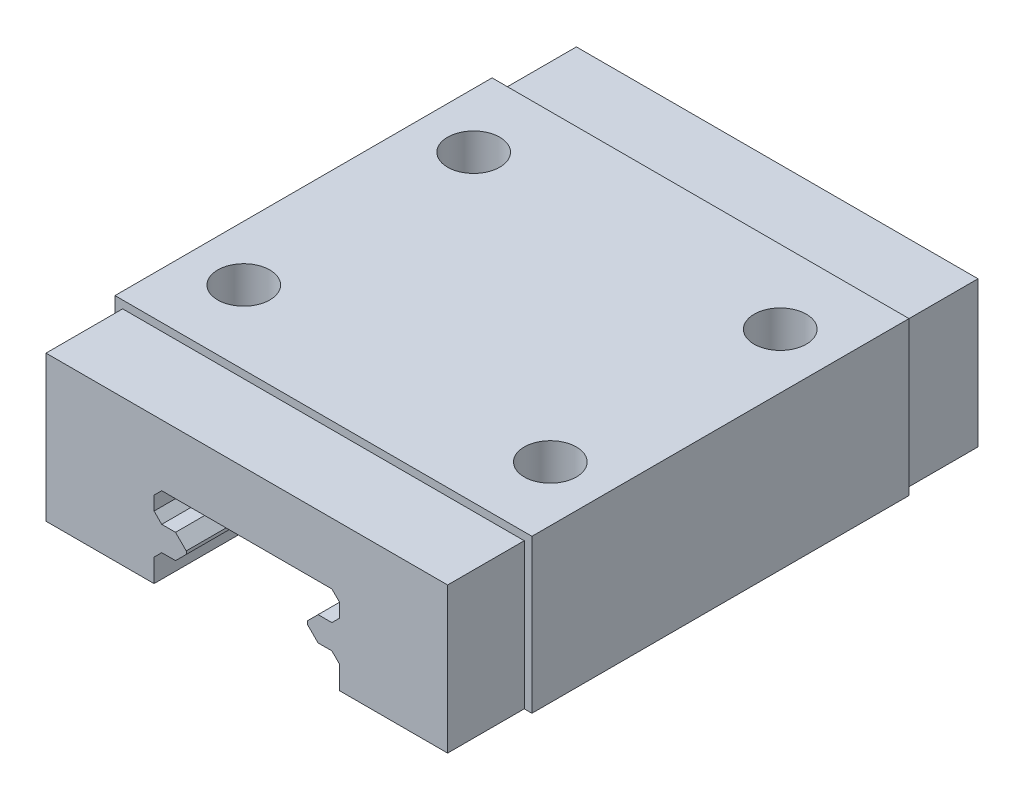
from build123d import *

# Parameters (mm, degrees)
SKETCH1_W                = 27.2
SKETCH1_H                = 10
BOSS_EXTRUDE1_DEPTH      = 34.6
CUT_EXTRUDE1_DEPTH       = 38.511598206
CUT_EXTRUDE1_DEPTH_BACK  = 34.6
CHAMFER1_SIZE            = 0.7
M3_CLEARANCE_HOLE1_D     = 3.4
M3_CLEARANCE_HOLE1_DEPTH = 5
M3_CLEARANCE_HOLE1_TIP   = 1.021463052
SKETCH7_W                = 27.2
SKETCH7_H                = 5
CUT_EXTRUDE2_DEPTH       = 0.5
SKETCH8_W                = 5
SKETCH8_H                = 9.5
CUT_EXTRUDE3_DEPTH       = 0.5


with BuildPart() as part:
    # Sketch1 → Boss-Extrude1 (new body)
    with BuildSketch(Plane.XY):
        Rectangle(SKETCH1_W, SKETCH1_H)
    extrude(amount=BOSS_EXTRUDE1_DEPTH)

    # Sketch2 → Cut-Extrude1 (cut, two sides: drawn at the far end of the back side and taken through both)
    with BuildSketch(Plane.XY.offset(34.6).offset(-CUT_EXTRUDE1_DEPTH_BACK)):
        Polygon((-5.55, -3), (-6.05, -3.5), (-6.05, -5), (6.05, -5), (6.05, -3.5), (5.55, -3), (3.95, -3), (3.95, -1.4), (5.55, -1.4), (6.05, -0.9), (6.05, 0), (5.55, 0.5), (-5.55, 0.5), (-6.05, 0), (-6.05, -0.9), (-5.55, -1.4), (-3.95, -1.4), (-3.95, -3), align=None)
    extrude(amount=CUT_EXTRUDE1_DEPTH + CUT_EXTRUDE1_DEPTH_BACK, mode=Mode.SUBTRACT)

    # Chamfer1
    chamfer1_edges = [part.edges().sort_by_distance(p)[0] for p in [
        (-3.95, -3, 17.3),
        (-3.95, -1.4, 17.3),
        (3.95, -3, 17.3),
        (3.95, -1.4, 17.3),
    ]]
    chamfer(chamfer1_edges, length=CHAMFER1_SIZE)

    # M3 Clearance Hole1
    with Locations(Plane(origin=(0, 5, 0), x_dir=(1, 0, 0), z_dir=(0, 1, 0))):
        with Locations((-10, -24.8), (-10, -9.8), (10, -9.8), (10, -24.8)):
            Hole(M3_CLEARANCE_HOLE1_D / 2, depth=M3_CLEARANCE_HOLE1_DEPTH)
            with Locations((0, 0, -(M3_CLEARANCE_HOLE1_DEPTH + M3_CLEARANCE_HOLE1_TIP / 2))):  # 118° drill point
                Cone(0, M3_CLEARANCE_HOLE1_D / 2, M3_CLEARANCE_HOLE1_TIP, mode=Mode.SUBTRACT)

    # Sketch7 → Cut-Extrude2 (cut)
    with BuildSketch(Plane(origin=(0, 5, 0), x_dir=(1, 0, 0), z_dir=(0, 1, 0))):
        with Locations((0, -32.1)):
            Rectangle(SKETCH7_W, SKETCH7_H)
        with Locations((0, -2.5)):
            Rectangle(SKETCH7_W, SKETCH7_H)
    extrude(amount=-CUT_EXTRUDE2_DEPTH, mode=Mode.SUBTRACT)

    # Sketch8 → Cut-Extrude3 (cut)
    with BuildSketch(Plane(origin=(13.6, 0, 0), x_dir=(0, 0, -1), z_dir=(1, 0, 0))):
        with Locations((-32.1, -0.25)):
            Rectangle(SKETCH8_W, SKETCH8_H)
        with Locations((-2.5, -0.25)):
            Rectangle(SKETCH8_W, SKETCH8_H)
    cut_extrude3 = extrude(amount=-CUT_EXTRUDE3_DEPTH, mode=Mode.SUBTRACT)

    # Mirror1: Cut-Extrude3 across plane
    add(cut_extrude3.mirror(Plane(origin=(0, 0, 0), x_dir=(0, 0, 1), z_dir=(1, 0, 0))), mode=Mode.SUBTRACT)


solid = part.part
